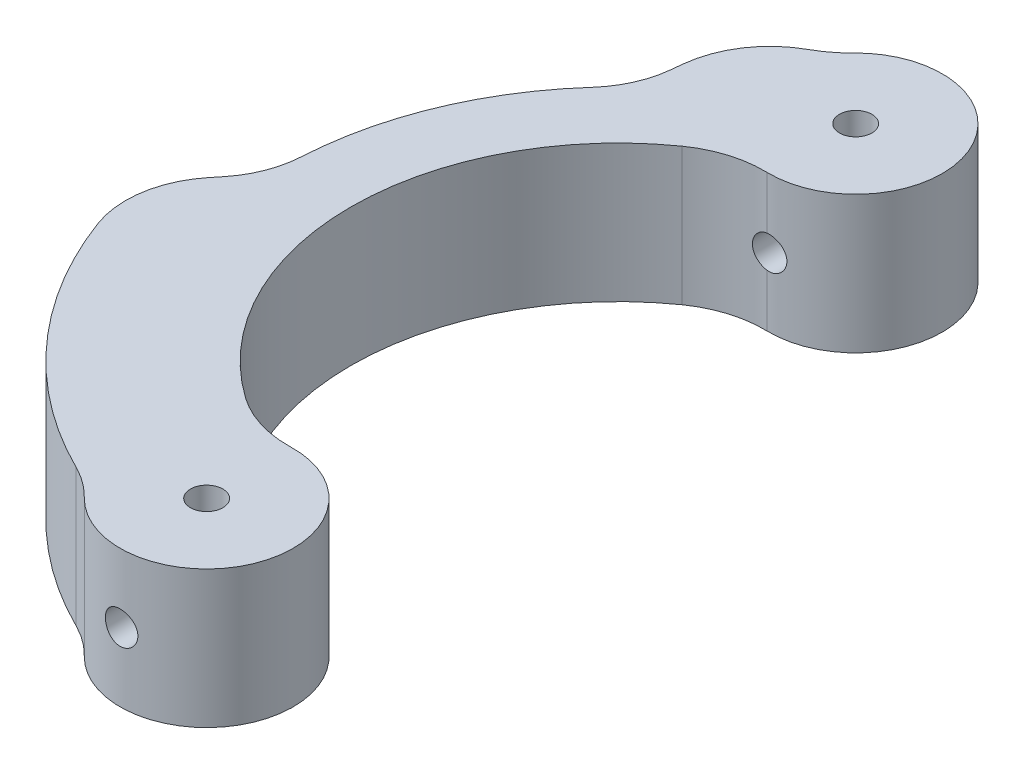
from build123d import *

# Parameters (mm, degrees)
SKETCH1_R               = 0.75
BOSS_EXTRUDE1_DEPTH     = 6.35
SKETCH2_R               = 4
SKETCH2_R_2             = 1.5
BOSS_EXTRUDE2_DEPTH     = 6.35
FILLET1_R               = 5
CUT_EXTRUDE1_DEPTH      = 36.18011987
CUT_EXTRUDE1_DEPTH_BACK = 36.18011987
FILLET2_R               = 4.5
CUT_EXTRUDE2_DEPTH      = 35.797952793
CUT_EXTRUDE2_DEPTH_BACK = 35.797952793
SKETCH5_R               = 0.75


with BuildPart() as part:
    # Sketch1 → Boss-Extrude1 (new body)
    with BuildSketch(Plane(origin=(0, 0, 0), x_dir=(1, 0, 0), z_dir=(0, 1, 0))):
        with BuildLine():
            ThreePointArc((0, 0), (-9.156655288, -11.933185502), (0, -23.866371003))
            ThreePointArc((0, -23.866371003), (2.24506403, -27.75493597), (-1.643500936, -30))
            ThreePointArc((-1.643500936, -30), (-15.506655288, -11.933185502), (-1.643500936, 6.133628997))
            ThreePointArc((-1.643500936, 6.133628997), (2.24506403, 3.888564967), (0, 0))
        make_face()
        with Locations(Location((-0.821750468, 3.066814498, 0), (0, 0, 270))):
            Circle(SKETCH1_R, mode=Mode.SUBTRACT)
        with Locations(Location((-0.821750468, -26.933185502, 0), (0, 0, 270))):
            Circle(SKETCH1_R, mode=Mode.SUBTRACT)
    extrude(amount=BOSS_EXTRUDE1_DEPTH)

    # Sketch2 → Boss-Extrude2 (add)
    # profile 1 of 2: a face of its own
    with BuildSketch(Plane(origin=(0, 6.35, 0), x_dir=(1, 0, 0), z_dir=(0, 1, 0))):
        with Locations((-0.821750468, 3.066814498)):
            Circle(SKETCH2_R)
        with Locations((-0.821750468, 3.066814498)):
            Circle(SKETCH2_R_2, mode=Mode.SUBTRACT)
    # profile 2 of 2: a face of its own
    with BuildSketch(Plane(origin=(0, 6.35, 0), x_dir=(1, 0, 0), z_dir=(0, 1, 0))):
        with Locations((-0.821750468, -26.933185502)):
            Circle(SKETCH2_R)
        with Locations((-0.821750468, -26.933185502)):
            Circle(SKETCH2_R_2, mode=Mode.SUBTRACT)
    extrude(amount=-BOSS_EXTRUDE2_DEPTH)

    # Fillet1
    fillet1_edges = [part.edges().sort_by_distance(p)[0] for p in [
        (-2.038682942, 3.175, 0.743575948),
        (-4.166745827, 3.175, -5.260215066),
        (-2.038682942, 3.175, 23.122795055),
        (-4.166745827, 3.175, 29.126586069),
    ]]
    fillet(fillet1_edges, radius=FILLET1_R)

    # Sketch4 → Cut-Extrude1 (cut, two sides: drawn at the far end of the back side and taken through both)
    with BuildSketch(Plane(origin=(0, 6.35, 0), x_dir=(1, 0, 0), z_dir=(0, 1, 0)).offset(-CUT_EXTRUDE1_DEPTH_BACK)):
        with BuildLine():
            Line((-7.783274695, -0.952423388), (-10.028338726, 1.292640642))
            ThreePointArc((-10.028338726, 1.292640642), (-14.082887201, -4.775419971), (-15.506655288, -11.933185502))
            Line((-15.506655288, -11.933185502), (-12.331655288, -11.933185502))
            ThreePointArc((-12.331655288, -11.933185502), (-11.149569685, -5.990439869), (-7.783274695, -0.952423388))
        make_face()
    extrude(amount=CUT_EXTRUDE1_DEPTH + CUT_EXTRUDE1_DEPTH_BACK, mode=Mode.SUBTRACT)

    # Chamfer1
    # the kernel refuses this chamfer: 3.25 mm, written as the material it takes off along each edge
    with BuildSketch(Plane(origin=(-15.506655288, -10.121546279, 11.933185502), x_dir=(0.9996220644729643, 0, -0.02749051143228412), z_dir=(0, 1, 0))) as chamfer1_piece_1_section:
        with BuildLine():
            Line((3.678679732, 0), (0.225552245, -4.042330768))
            Line((0.225552245, -4.042330768), (0.161654076, -4.054248153))
            ThreePointArc((0.161654076, -4.054248153), (-0.010664321, -2.031175025), (-0.064975434, 0.001786883))
            Line((-0.064975434, 0.001786883), (0.001786883, 0.064975434))
            ThreePointArc((0.001786883, 0.064975434), (1.839736708, 0.014430151), (3.680466615, 0.064975434))
            Line((3.680466615, 0.064975434), (3.678679732, 0))
        make_face()
    chamfer1_piece_1 = extrude(amount=26.593092558, mode=Mode.PRIVATE)
    chamfer1_piece_1 = chamfer1_piece_1 - Plane(origin=(3.197487418, 3.175, 11.933185502), x_dir=(-1, 0, 0), z_dir=(0, -1, 0)) * Cylinder(15.529142706, 70, mode=Mode.PRIVATE)
    add(chamfer1_piece_1, mode=Mode.SUBTRACT)
    with BuildSketch(Plane(origin=(-10.028338726, -10.121546279, -1.292640642), x_dir=(0.7634460432280789, 0, -0.6458716119163239), z_dir=(0, 1, 0))) as chamfer1_piece_2_section:
        with BuildLine():
            Line((4.048618512, 0), (0.204942617, -3.672966525))
            Line((0.204942617, -3.672966525), (0.140167642, -3.678370474))
            ThreePointArc((0.140167642, -3.678370474), (0.088085677, -1.837683405), (-0.064774975, -0.005403949))
            Line((-0.064774975, -0.005403949), (-0.005403949, 0.064774975))
            ThreePointArc((-0.005403949, 0.064774975), (2.027426371, 0.123806379), (4.056957562, 0.064462859))
            Line((4.056957562, 0.064462859), (4.048618512, 0))
        make_face()
    chamfer1_piece_2 = extrude(amount=26.593092558, mode=Mode.PRIVATE)
    chamfer1_piece_2 = chamfer1_piece_2 - Plane(origin=(3.197487418, 3.175, 11.933185502), x_dir=(-1, 0, 0), z_dir=(0, -1, 0)) * Cylinder(15.529142706, 70, mode=Mode.PRIVATE)
    add(chamfer1_piece_2, mode=Mode.SUBTRACT)

    # Fillet2
    fillet2_edges = [part.edges().sort_by_distance(p)[0] for p in [
        (-7.416497134, 3.175, 0.597507087),
        (-12.32326811, 3.175, 12.443500126),
        (-6.951183486, 3.175, -3.778257247),
        (-15.088374308, 3.175, 15.866659195),
    ]]
    fillet(fillet2_edges, radius=FILLET2_R)

    # Sketch5 → Cut-Extrude2 (cut, two sides: drawn at the far end of the back side and taken through both)
    with BuildSketch(Plane.XY.offset(-CUT_EXTRUDE2_DEPTH_BACK)):
        with Locations((-0.821750468, 3.175)):
            Circle(SKETCH5_R)
    extrude(amount=CUT_EXTRUDE2_DEPTH + CUT_EXTRUDE2_DEPTH_BACK, mode=Mode.SUBTRACT)


solid = part.part
